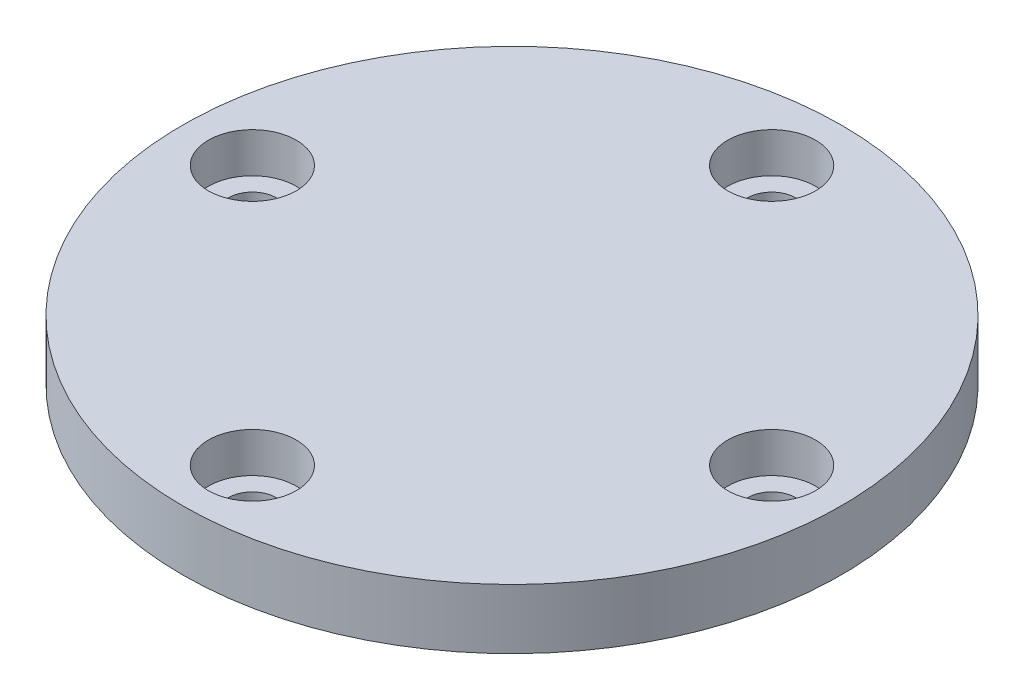
from build123d import *

# Parameters (mm, degrees)
SKETCH1_R                      = 16.5
BOSS_EXTRUDE1_DEPTH            = 3
CBORE_FOR_M2_SHCS1_D           = 2.4
CBORE_FOR_M2_SHCS1_CBORE_D     = 4.4
CBORE_FOR_M2_SHCS1_CBORE_DEPTH = 2
CIRPATTERN1_COUNT              = 4
SKETCH15_R                     = 0.5
CUT_EXTRUDE1_DEPTH             = 1.5


with BuildPart() as part:
    # Sketch1 → Boss-Extrude1 (new body)
    with BuildSketch(Plane(origin=(0, 0, 0), x_dir=(1, 0, 0), z_dir=(0, 1, 0))):
        Circle(SKETCH1_R)
    extrude(amount=BOSS_EXTRUDE1_DEPTH)

    # CBORE for M2 SHCS1 (through all)
    with Locations(Plane(origin=(0, 3, 0), x_dir=(1, 0, 0), z_dir=(0, 1, 0))):
        with Locations((-13, 0)):
            cbore_for_m2_shcs1 = CounterBoreHole(CBORE_FOR_M2_SHCS1_D / 2, CBORE_FOR_M2_SHCS1_CBORE_D / 2, CBORE_FOR_M2_SHCS1_CBORE_DEPTH)

    # CirPattern1: CBORE for M2 SHCS1 ×4 about axis
    cirpattern1_axis = Axis((0, 3, 0), (0, 1, 0))
    for i in range(1, CIRPATTERN1_COUNT):
        add(cbore_for_m2_shcs1.rotate(cirpattern1_axis, i * 360 / CIRPATTERN1_COUNT), mode=Mode.SUBTRACT)

    # Sketch15 → Cut-Extrude1 (cut)
    with BuildSketch(Plane.XZ):
        with Locations((6, 0)):
            Circle(SKETCH15_R)
    extrude(amount=-CUT_EXTRUDE1_DEPTH, mode=Mode.SUBTRACT)


solid = part.part
